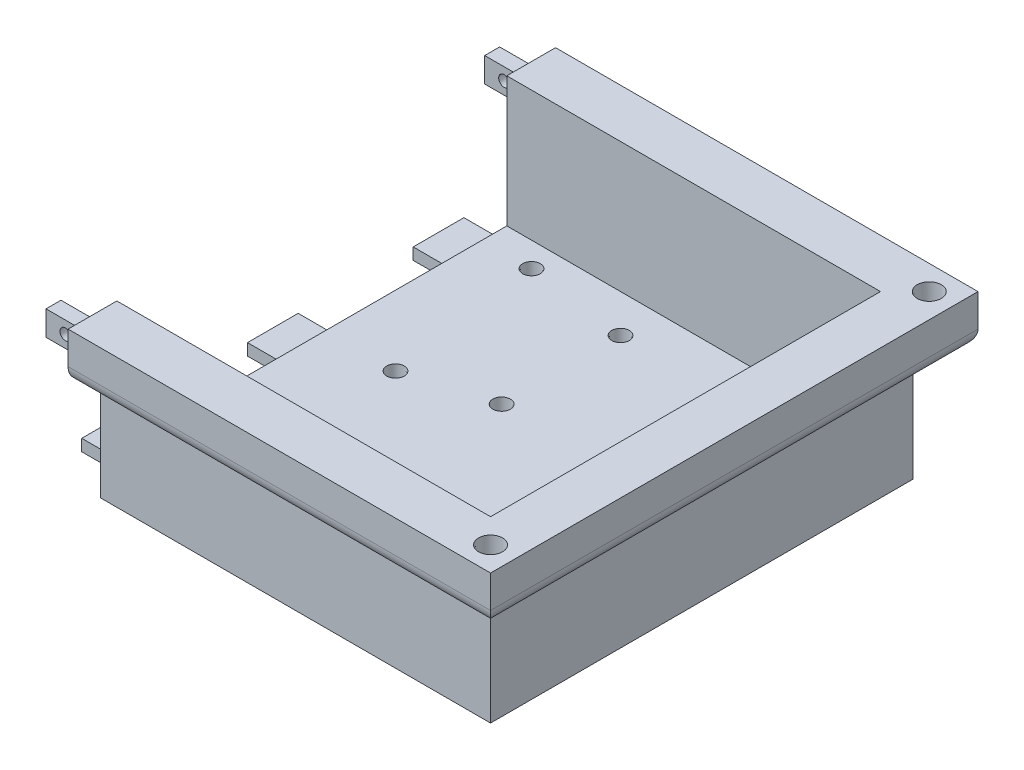
from build123d import *
from OCP.BRepFilletAPI import BRepFilletAPI_MakeChamfer

# Parameters (mm, degrees)
SKETCH1_W                = 205
SKETCH1_H                = 130
BOSS_EXTRUDE1_DEPTH      = 10
SKETCH2_W                = 205
SKETCH2_H                = 130
SKETCH2_W_2              = 195
SKETCH2_H_2              = 120
BOSS_EXTRUDE2_DEPTH      = 40
CUT_EXTRUDE1_REACH       = 222.794
SKETCH6_W                = 60
SKETCH6_H                = 40
HOLE1_D                  = 4.8
HOLE1_DEPTH              = 8
HOLE1_CBORE_D            = 5.4
HOLE1_CBORE_DEPTH        = 6
CHAMFER1_SIZE            = 6
CHAMFER1_SIZE_2          = 0.3
BOSS_EXTRUDE3_DEPTH      = 15
FILLET1_R                = 5
HOLE2_D                  = 6.8
HOLE2_DEPTH              = 10
HOLE2_CBORE_D            = 7.4
HOLE2_CBORE_DEPTH        = 6
CHAMFER2_SIZE            = 6
CHAMFER2_SIZE_2          = 0.3
SKETCH14_W               = 179.585790587
SKETCH14_H               = 72.16534995
CUT_EXTRUDE2_DEPTH       = 150
SKETCH15_W               = 15.6
SKETCH15_H               = 3.6
SKETCH15_W_2             = 4.6
SKETCH15_H_2             = 7.6
BOSS_EXTRUDE4_DEPTH      = 12
M3_CLEARANCE_HOLE1_D     = 3.4
M3_CLEARANCE_HOLE1_DEPTH = 9.8


with BuildPart() as part:
    # Sketch1 → Boss-Extrude1 (new body)
    with BuildSketch(Plane(origin=(0, 0, 0), x_dir=(1, 0, 0), z_dir=(0, 1, 0))):
        Rectangle(SKETCH1_W, SKETCH1_H)
    extrude(amount=BOSS_EXTRUDE1_DEPTH)

    # Sketch2 → Boss-Extrude2 (add)
    with BuildSketch(Plane(origin=(0, 10, 0), x_dir=(1, 0, 0), z_dir=(0, 1, 0))):
        Rectangle(SKETCH2_W, SKETCH2_H)
        Rectangle(SKETCH2_W_2, SKETCH2_H_2, mode=Mode.SUBTRACT)
    extrude(amount=BOSS_EXTRUDE2_DEPTH)

    # Sketch6 → Cut-Extrude1 (cut, up to next)
    with BuildSketch(Plane.ZY.offset(102.5), mode=Mode.PRIVATE) as cut_extrude1_sk1:
        with Locations((-30, 30)):
            Rectangle(SKETCH6_W, SKETCH6_H)
    cut_extrude1_tool1 = extrude(cut_extrude1_sk1.sketch, amount=-CUT_EXTRUDE1_REACH, mode=Mode.PRIVATE) & part.part
    add(cut_extrude1_tool1.solids().sort_by_distance((-102.5, 30, -30))[0], mode=Mode.SUBTRACT)

    # Hole1
    with Locations(Plane(origin=(0, 10, 0), x_dir=(1, 0, 0), z_dir=(0, 1, 0))):
        with Locations((-84.35, -28.5), (-10.65, -28.5), (-78.5, 4.2), (-77.2, 52.4), (-26.4, 9.3), (-26.4, 37.2), (-2.3, 52.4), (4.05, 4.2), (29.2, 48.3), (65.8, 48.3), (65.8, 11.7), (29.2, 11.7), (10.65, -28.5), (84.35, -28.5)):
            CounterBoreHole(HOLE1_D / 2, HOLE1_CBORE_D / 2, HOLE1_CBORE_DEPTH, depth=HOLE1_DEPTH)

    # Chamfer1
    chamfer1_edges_1 = [part.edges().sort_by_distance(p)[0] for p in [
        (-5, 4, -52.4),
    ]]
    chamfer1_side_1 = [part.faces().sort_by_distance(p)[0] for p in [
        (-5, 4.006, -52.4),
    ]]
    chamfer1_edges_2 = [part.edges().sort_by_distance(p)[0] for p in [
        (-29.1, 4, -37.2),
    ]]
    chamfer1_side_2 = [part.faces().sort_by_distance(p)[0] for p in [
        (-29.1, 4.006, -37.2),
    ]]
    chamfer1_edges_3 = [part.edges().sort_by_distance(p)[0] for p in [
        (-29.1, 4, -9.3),
    ]]
    chamfer1_side_3 = [part.faces().sort_by_distance(p)[0] for p in [
        (-29.1, 4.006, -9.3),
    ]]
    chamfer1_edges_4 = [part.edges().sort_by_distance(p)[0] for p in [
        (-79.9, 4, -52.4),
    ]]
    chamfer1_side_4 = [part.faces().sort_by_distance(p)[0] for p in [
        (-79.9, 4.006, -52.4),
    ]]
    chamfer1_edges_5 = [part.edges().sort_by_distance(p)[0] for p in [
        (-81.2, 4, -4.2),
    ]]
    chamfer1_side_5 = [part.faces().sort_by_distance(p)[0] for p in [
        (-81.2, 4.006, -4.2),
    ]]
    chamfer1_edges_6 = [part.edges().sort_by_distance(p)[0] for p in [
        (-13.35, 4, 28.5),
    ]]
    chamfer1_side_6 = [part.faces().sort_by_distance(p)[0] for p in [
        (-13.35, 4.006, 28.5),
    ]]
    chamfer1_edges_7 = [part.edges().sort_by_distance(p)[0] for p in [
        (-87.05, 4, 28.5),
    ]]
    chamfer1_side_7 = [part.faces().sort_by_distance(p)[0] for p in [
        (-87.05, 4.006, 28.5),
    ]]
    chamfer1_edges_8 = [part.edges().sort_by_distance(p)[0] for p in [
        (81.65, 4, 28.5),
    ]]
    chamfer1_side_8 = [part.faces().sort_by_distance(p)[0] for p in [
        (81.65, 4.006, 28.5),
    ]]
    chamfer1_edges_9 = [part.edges().sort_by_distance(p)[0] for p in [
        (7.95, 4, 28.5),
    ]]
    chamfer1_side_9 = [part.faces().sort_by_distance(p)[0] for p in [
        (7.95, 4.006, 28.5),
    ]]
    chamfer1_edges_10 = [part.edges().sort_by_distance(p)[0] for p in [
        (26.5, 4, -11.7),
    ]]
    chamfer1_side_10 = [part.faces().sort_by_distance(p)[0] for p in [
        (26.5, 4.006, -11.7),
    ]]
    chamfer1_edges_11 = [part.edges().sort_by_distance(p)[0] for p in [
        (63.1, 4, -11.7),
    ]]
    chamfer1_side_11 = [part.faces().sort_by_distance(p)[0] for p in [
        (63.1, 4.006, -11.7),
    ]]
    chamfer1_edges_12 = [part.edges().sort_by_distance(p)[0] for p in [
        (63.1, 4, -48.3),
    ]]
    chamfer1_side_12 = [part.faces().sort_by_distance(p)[0] for p in [
        (63.1, 4.006, -48.3),
    ]]
    chamfer1_edges_13 = [part.edges().sort_by_distance(p)[0] for p in [
        (26.5, 4, -48.3),
    ]]
    chamfer1_side_13 = [part.faces().sort_by_distance(p)[0] for p in [
        (26.5, 4.006, -48.3),
    ]]
    chamfer1_edges_14 = [part.edges().sort_by_distance(p)[0] for p in [
        (1.35, 4, -4.2),
    ]]
    chamfer1_side_14 = [part.faces().sort_by_distance(p)[0] for p in [
        (1.35, 4.006, -4.2),
    ]]
    chamfer1 = BRepFilletAPI_MakeChamfer(part.part.solid().wrapped)
    for e in chamfer1_edges_1:
        chamfer1.Add(CHAMFER1_SIZE - 0.0001, CHAMFER1_SIZE_2 - 0.0001, e.wrapped, chamfer1_side_1[0].wrapped)
    for e in chamfer1_edges_2:
        chamfer1.Add(CHAMFER1_SIZE - 0.0001, CHAMFER1_SIZE_2 - 0.0001, e.wrapped, chamfer1_side_2[0].wrapped)
    for e in chamfer1_edges_3:
        chamfer1.Add(CHAMFER1_SIZE - 0.0001, CHAMFER1_SIZE_2 - 0.0001, e.wrapped, chamfer1_side_3[0].wrapped)
    for e in chamfer1_edges_4:
        chamfer1.Add(CHAMFER1_SIZE - 0.0001, CHAMFER1_SIZE_2 - 0.0001, e.wrapped, chamfer1_side_4[0].wrapped)
    for e in chamfer1_edges_5:
        chamfer1.Add(CHAMFER1_SIZE - 0.0001, CHAMFER1_SIZE_2 - 0.0001, e.wrapped, chamfer1_side_5[0].wrapped)
    for e in chamfer1_edges_6:
        chamfer1.Add(CHAMFER1_SIZE - 0.0001, CHAMFER1_SIZE_2 - 0.0001, e.wrapped, chamfer1_side_6[0].wrapped)
    for e in chamfer1_edges_7:
        chamfer1.Add(CHAMFER1_SIZE - 0.0001, CHAMFER1_SIZE_2 - 0.0001, e.wrapped, chamfer1_side_7[0].wrapped)
    for e in chamfer1_edges_8:
        chamfer1.Add(CHAMFER1_SIZE - 0.0001, CHAMFER1_SIZE_2 - 0.0001, e.wrapped, chamfer1_side_8[0].wrapped)
    for e in chamfer1_edges_9:
        chamfer1.Add(CHAMFER1_SIZE - 0.0001, CHAMFER1_SIZE_2 - 0.0001, e.wrapped, chamfer1_side_9[0].wrapped)
    for e in chamfer1_edges_10:
        chamfer1.Add(CHAMFER1_SIZE - 0.0001, CHAMFER1_SIZE_2 - 0.0001, e.wrapped, chamfer1_side_10[0].wrapped)
    for e in chamfer1_edges_11:
        chamfer1.Add(CHAMFER1_SIZE - 0.0001, CHAMFER1_SIZE_2 - 0.0001, e.wrapped, chamfer1_side_11[0].wrapped)
    for e in chamfer1_edges_12:
        chamfer1.Add(CHAMFER1_SIZE - 0.0001, CHAMFER1_SIZE_2 - 0.0001, e.wrapped, chamfer1_side_12[0].wrapped)
    for e in chamfer1_edges_13:
        chamfer1.Add(CHAMFER1_SIZE - 0.0001, CHAMFER1_SIZE_2 - 0.0001, e.wrapped, chamfer1_side_13[0].wrapped)
    for e in chamfer1_edges_14:
        chamfer1.Add(CHAMFER1_SIZE - 0.0001, CHAMFER1_SIZE_2 - 0.0001, e.wrapped, chamfer1_side_14[0].wrapped)
    add(Compound.cast(chamfer1.Shape()), mode=Mode.REPLACE)  # a hair under: the kernel refuses the full size

    # Sketch11 → Boss-Extrude3 (add)
    with BuildSketch(Plane(origin=(0, 50, 0), x_dir=(1, 0, 0), z_dir=(0, 1, 0))):
        Polygon((-112.5, 75), (112.5, 75), (112.5, -75), (-112.5, -75), (-112.5, 0), (-102.5, 0), (-102.5, -65), (102.5, -65), (102.5, 65), (-102.5, 65), (-102.5, 60), (-112.5, 60), align=None)
    extrude(amount=-BOSS_EXTRUDE3_DEPTH)

    # Fillet1
    fillet1_edges = [part.edges().sort_by_distance(p)[0] for p in [
        (-112.5, 35, 37.5),
        (0, 35, 75),
        (112.5, 35, 0),
        (0, 35, -75),
        (-102.5, 35, -62.5),
        (0, 35, -65),
        (102.5, 35, 0),
        (-102.5, 35, 32.5),
        (0, 35, 65),
    ]]
    fillet(fillet1_edges, radius=FILLET1_R - 0.0001)  # a hair under: the kernel refuses the full size

    # Hole2
    with Locations(Plane(origin=(0, 50, 0), x_dir=(1, 0, 0), z_dir=(0, 1, 0))):
        with Locations((-105, 67.5), (105, 67.5), (105, -67.5), (-105, -67.5)):
            CounterBoreHole(HOLE2_D / 2, HOLE2_CBORE_D / 2, HOLE2_CBORE_DEPTH, depth=HOLE2_DEPTH)

    # Chamfer2
    chamfer2_edges_1 = [part.edges().sort_by_distance(p)[0] for p in [
        (-108.7, 44, 67.5),
    ]]
    chamfer2_side_1 = [part.faces().sort_by_distance(p)[0] for p in [
        (-108.7, 44.006, 67.5),
    ]]
    chamfer2_edges_2 = [part.edges().sort_by_distance(p)[0] for p in [
        (101.3, 44, 67.5),
    ]]
    chamfer2_side_2 = [part.faces().sort_by_distance(p)[0] for p in [
        (101.3, 44.006, 67.5),
    ]]
    chamfer2_edges_3 = [part.edges().sort_by_distance(p)[0] for p in [
        (101.3, 44, -67.5),
    ]]
    chamfer2_side_3 = [part.faces().sort_by_distance(p)[0] for p in [
        (101.3, 44.006, -67.5),
    ]]
    chamfer2_edges_4 = [part.edges().sort_by_distance(p)[0] for p in [
        (-108.7, 44, -67.5),
    ]]
    chamfer2_side_4 = [part.faces().sort_by_distance(p)[0] for p in [
        (-108.7, 44.006, -67.5),
    ]]
    chamfer2 = BRepFilletAPI_MakeChamfer(part.part.solid().wrapped)
    for e in chamfer2_edges_1:
        chamfer2.Add(CHAMFER2_SIZE - 0.0001, CHAMFER2_SIZE_2 - 0.0001, e.wrapped, chamfer2_side_1[0].wrapped)
    for e in chamfer2_edges_2:
        chamfer2.Add(CHAMFER2_SIZE - 0.0001, CHAMFER2_SIZE_2 - 0.0001, e.wrapped, chamfer2_side_2[0].wrapped)
    for e in chamfer2_edges_3:
        chamfer2.Add(CHAMFER2_SIZE - 0.0001, CHAMFER2_SIZE_2 - 0.0001, e.wrapped, chamfer2_side_3[0].wrapped)
    for e in chamfer2_edges_4:
        chamfer2.Add(CHAMFER2_SIZE - 0.0001, CHAMFER2_SIZE_2 - 0.0001, e.wrapped, chamfer2_side_4[0].wrapped)
    add(Compound.cast(chamfer2.Shape()), mode=Mode.REPLACE)  # a hair under: the kernel refuses the full size

    # Sketch14 → Cut-Extrude2 (cut)
    with BuildSketch(Plane.ZY.offset(17.5)):
        with Locations((-1.737927005, 26.484477579)):
            Rectangle(SKETCH14_W, SKETCH14_H)
    extrude(amount=CUT_EXTRUDE2_DEPTH, mode=Mode.SUBTRACT)

    # Sketch15 → Boss-Extrude4 (add)
    with BuildSketch(Plane.ZY.offset(17.5)):
        with Locations((-51, 5)):
            Rectangle(SKETCH15_W, SKETCH15_H)
        with Locations((51, 5)):
            Rectangle(SKETCH15_W, SKETCH15_H)
        with Locations((0, 5)):
            Rectangle(SKETCH15_W, SKETCH15_H)
        with Locations((-67.5, 43)):
            Rectangle(SKETCH15_W_2, SKETCH15_H_2)
        with Locations((67.5, 43)):
            Rectangle(SKETCH15_W_2, SKETCH15_H_2)
    extrude(amount=BOSS_EXTRUDE4_DEPTH)

    # M3 Clearance Hole1
    with Locations(Plane.XY.offset(-65.2)):
        with Locations((-23.5, 43)):
            m3_clearance_hole1 = Hole(M3_CLEARANCE_HOLE1_D / 2, depth=M3_CLEARANCE_HOLE1_DEPTH)

    # Mirror1: M3 Clearance Hole1 across plane
    add(m3_clearance_hole1.mirror(Plane.XY), mode=Mode.SUBTRACT)


solid = part.part
